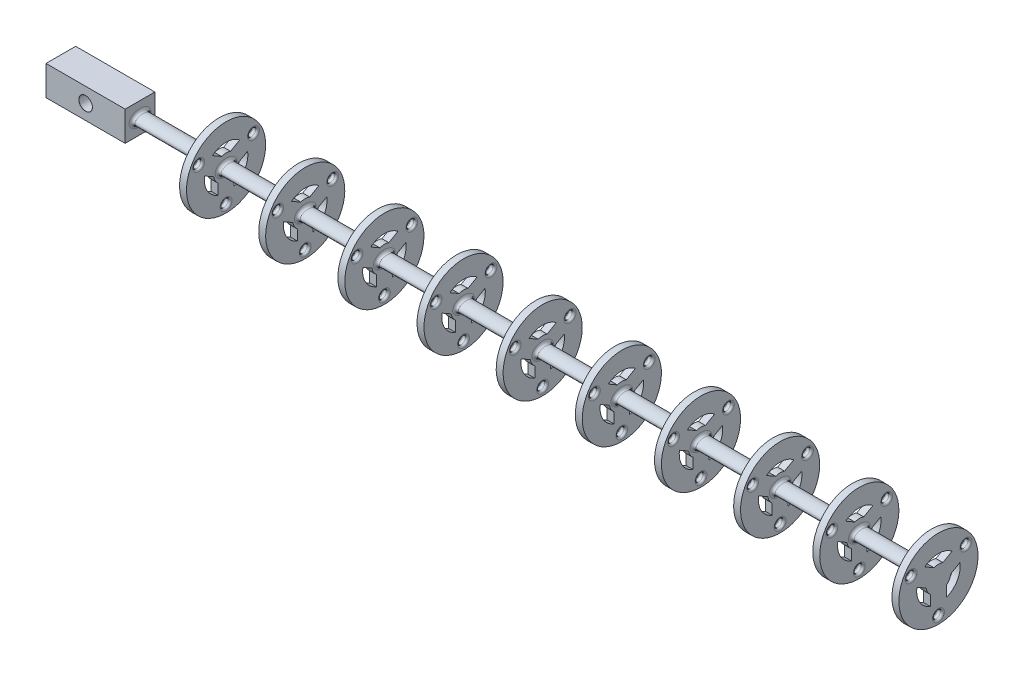
from build123d import *

# Parameters (mm, degrees)
SKETCH21_RX                    = 2
SKETCH21_RY                    = 1.25
BOSS_EXTRUDE6_DEPTH            = 200
SKETCH3_W                      = 1.75
SKETCH3_H                      = 10
CUT_EXTRUDE1_REACH             = 180.81
SKETCH5_R                      = 1
FILLET1_R                      = 0.5
LPATTERN1_COUNT                = 10
LPATTERN1_PITCH                = 20
FILLET1_OF_LPATTERN1_R         = 0.5
SKETCH16_W                     = 7.5
SKETCH16_H                     = 7.5
BOSS_EXTRUDE1_DEPTH            = 20
M3_CLEARANCE_HOLE1_D           = 3.4
M3_CLEARANCE_HOLE1_CSINK_D     = 3.45
M3_CLEARANCE_HOLE1_CSINK_ANGLE = 90
FILLET2_R                      = 0.75


with BuildPart() as part:
    # Sketch21 → Boss-Extrude6 (new body)
    with BuildSketch(Plane(origin=(0, 0, 0), x_dir=(0, 0, -1), z_dir=(1, 0, 0))):
        with Locations((0, 0)):
            Ellipse(SKETCH21_RX, SKETCH21_RY)
    extrude(amount=BOSS_EXTRUDE6_DEPTH)

    # Sketch3 → Revolve2 (revolve)
    with BuildSketch(Plane.XY):
        with Locations((20.875, 5)):
            Rectangle(SKETCH3_W, SKETCH3_H)
    revolve2 = revolve(axis=Axis((21.75, 0, 0), (-1, 0, 0)))

    # Sketch5 → Cut-Extrude1 (cut, up to next)
    with BuildSketch(Plane(origin=(21.75, 0, 0), x_dir=(0, 0, -1), z_dir=(1, 0, 0)), mode=Mode.PRIVATE) as cut_extrude1_sk1:
        with Locations((0, -8)):
            Circle(SKETCH5_R)
    cut_extrude1_tool1 = extrude(cut_extrude1_sk1.sketch, amount=-CUT_EXTRUDE1_REACH, mode=Mode.PRIVATE) & part.part
    # Sketch5 → Cut-Extrude1 (cut, up to next)
    with BuildSketch(Plane(origin=(21.75, 0, 0), x_dir=(0, 0, -1), z_dir=(1, 0, 0)), mode=Mode.PRIVATE) as cut_extrude1_sk2:
        with Locations((6.92820323, 4)):
            Circle(SKETCH5_R)
    cut_extrude1_tool2 = extrude(cut_extrude1_sk2.sketch, amount=-CUT_EXTRUDE1_REACH, mode=Mode.PRIVATE) & part.part
    # Sketch5 → Cut-Extrude1 (cut, up to next)
    with BuildSketch(Plane(origin=(21.75, 0, 0), x_dir=(0, 0, -1), z_dir=(1, 0, 0)), mode=Mode.PRIVATE) as cut_extrude1_sk3:
        with Locations((-6.92820323, 4)):
            Circle(SKETCH5_R)
    cut_extrude1_tool3 = extrude(cut_extrude1_sk3.sketch, amount=-CUT_EXTRUDE1_REACH, mode=Mode.PRIVATE) & part.part
    # Sketch5 → Cut-Extrude1 (cut, up to next)
    with BuildSketch(Plane(origin=(21.75, 0, 0), x_dir=(0, 0, -1), z_dir=(1, 0, 0)), mode=Mode.PRIVATE) as cut_extrude1_sk4:
        with BuildLine():
            Line((-3.437059837, 4.293788499), (-1.128202797, 2.960769265))
            ThreePointArc((-1.128202797, 2.960769265), (0, 3.1684375), (1.128202797, 2.960769265))
            Line((1.128202797, 2.960769265), (3.437059837, 4.293788499))
            ThreePointArc((3.437059837, 4.293788499), (0, 5.5), (-3.437059837, 4.293788499))
        make_face()
    cut_extrude1_tool4 = extrude(cut_extrude1_sk4.sketch, amount=-CUT_EXTRUDE1_REACH, mode=Mode.PRIVATE) & part.part
    # Sketch5 → Cut-Extrude1 (cut, up to next)
    with BuildSketch(Plane(origin=(21.75, 0, 0), x_dir=(0, 0, -1), z_dir=(1, 0, 0)), mode=Mode.PRIVATE) as cut_extrude1_sk5:
        with BuildLine():
            Line((2, -2.457436915), (2, -5.123475383))
            ThreePointArc((2, -5.123475383), (4.763139721, -2.75), (5.437059837, 0.829686884))
            Line((5.437059837, 0.829686884), (3.128202797, -0.50333235))
            ThreePointArc((3.128202797, -0.50333235), (2.743947365, -1.58421875), (2, -2.457436915))
        make_face()
    cut_extrude1_tool5 = extrude(cut_extrude1_sk5.sketch, amount=-CUT_EXTRUDE1_REACH, mode=Mode.PRIVATE) & part.part
    # Sketch5 → Cut-Extrude1 (cut, up to next)
    with BuildSketch(Plane(origin=(21.75, 0, 0), x_dir=(0, 0, -1), z_dir=(1, 0, 0)), mode=Mode.PRIVATE) as cut_extrude1_sk6:
        with BuildLine():
            Line((-3.128202797, -0.50333235), (-5.437059837, 0.829686884))
            ThreePointArc((-5.437059837, 0.829686884), (-4.763139721, -2.75), (-2, -5.123475383))
            Line((-2, -5.123475383), (-2, -2.457436915))
            ThreePointArc((-2, -2.457436915), (-2.743947365, -1.58421875), (-3.128202797, -0.50333235))
        make_face()
    cut_extrude1_tool6 = extrude(cut_extrude1_sk6.sketch, amount=-CUT_EXTRUDE1_REACH, mode=Mode.PRIVATE) & part.part
    cut_extrude1_1 = cut_extrude1_tool1.solids().sort_by_distance((21.75, -8, 0))[0]
    add(cut_extrude1_1, mode=Mode.SUBTRACT)
    cut_extrude1_2 = cut_extrude1_tool2.solids().sort_by_distance((21.75, 4, -6.928203))[0]
    add(cut_extrude1_2, mode=Mode.SUBTRACT)
    cut_extrude1_3 = cut_extrude1_tool3.solids().sort_by_distance((21.75, 4, 6.928203))[0]
    add(cut_extrude1_3, mode=Mode.SUBTRACT)
    cut_extrude1_4 = cut_extrude1_tool4.solids().sort_by_distance((21.75, 4.274526, 0))[0]
    add(cut_extrude1_4, mode=Mode.SUBTRACT)
    cut_extrude1_5 = cut_extrude1_tool5.solids().sort_by_distance((21.75, -2.137263, -3.701848))[0]
    add(cut_extrude1_5, mode=Mode.SUBTRACT)
    cut_extrude1_6 = cut_extrude1_tool6.solids().sort_by_distance((21.75, -2.137263, 3.701848))[0]
    add(cut_extrude1_6, mode=Mode.SUBTRACT)
    cut_extrude1 = cut_extrude1_1 + cut_extrude1_2 + cut_extrude1_3 + cut_extrude1_4 + cut_extrude1_5 + cut_extrude1_6  # Cut-Extrude1 as one shape, for the pattern or mirror that repeats it

    # Fillet1
    fillet1_edges = [part.edges().sort_by_distance(p)[0] for p in [
        (20, 4, -5.92820323),
        (20, -8, 1),
        (21.75, -8, 1),
        (21.75, 4, -5.92820323),
        (20, 4, 7.92820323),
        (21.75, 4, 7.92820323),
    ]]
    fillet(fillet1_edges, radius=FILLET1_R)

    # LPattern1: Revolve2, Cut-Extrude1 ×10
    with Locations(*[(i * LPATTERN1_PITCH, 0, 0) for i in range(1, LPATTERN1_COUNT)]):
        add(revolve2)
        add(cut_extrude1, mode=Mode.SUBTRACT)

    # Fillet1 of LPattern1
    fillet1_of_lpattern1_edges = [part.edges().sort_by_distance(p)[0] for p in [
        (40, 4, -5.92820323),
        (40, -8, 1),
        (41.75, -8, 1),
        (41.75, 4, -5.92820323),
        (40, 4, 7.92820323),
        (41.75, 4, 7.92820323),
        (60, 4, -5.92820323),
        (60, -8, 1),
        (61.75, -8, 1),
        (61.75, 4, -5.92820323),
        (60, 4, 7.92820323),
        (61.75, 4, 7.92820323),
        (80, 4, -5.92820323),
        (80, -8, 1),
        (81.75, -8, 1),
        (81.75, 4, -5.92820323),
        (80, 4, 7.92820323),
        (81.75, 4, 7.92820323),
        (100, 4, -5.92820323),
        (100, -8, 1),
        (101.75, -8, 1),
        (101.75, 4, -5.92820323),
        (100, 4, 7.92820323),
        (101.75, 4, 7.92820323),
        (120, 4, -5.92820323),
        (120, -8, 1),
        (121.75, -8, 1),
        (121.75, 4, -5.92820323),
        (120, 4, 7.92820323),
        (121.75, 4, 7.92820323),
        (140, 4, -5.92820323),
        (140, -8, 1),
        (141.75, -8, 1),
        (141.75, 4, -5.92820323),
        (140, 4, 7.92820323),
        (141.75, 4, 7.92820323),
        (160, 4, -5.92820323),
        (160, -8, 1),
        (161.75, -8, 1),
        (161.75, 4, -5.92820323),
        (160, 4, 7.92820323),
        (161.75, 4, 7.92820323),
        (180, 4, -5.92820323),
        (180, -8, 1),
        (181.75, -8, 1),
        (181.75, 4, -5.92820323),
        (180, 4, 7.92820323),
        (181.75, 4, 7.92820323),
        (200, 4, -5.92820323),
        (200, -8, 1),
        (201.75, -8, 1),
        (201.75, 4, -5.92820323),
        (200, 4, 7.92820323),
        (201.75, 4, 7.92820323),
    ]]
    fillet(fillet1_of_lpattern1_edges, radius=FILLET1_OF_LPATTERN1_R)

    # Sketch16 → Boss-Extrude1 (add)
    with BuildSketch(Plane(origin=(0, 0, 0), x_dir=(0, 0, -1), z_dir=(1, 0, 0))):
        Rectangle(SKETCH16_W, SKETCH16_H)
    extrude(amount=-BOSS_EXTRUDE1_DEPTH)

    # M3 Clearance Hole1 (through all)
    with Locations(Plane.XY.offset(3.75)):
        with Locations((-10, 0)):
            CounterSinkHole(M3_CLEARANCE_HOLE1_D / 2, M3_CLEARANCE_HOLE1_CSINK_D / 2, counter_sink_angle=M3_CLEARANCE_HOLE1_CSINK_ANGLE)

    # Fillet2
    fillet2_edges = [part.edges().sort_by_distance(p)[0] for p in [
        (200, -0.002166608, 1.999996996),
        (181.75, 0, 2.000000063),
        (180, 0, 2.000000063),
        (161.75, 0, 2.000000063),
        (160, 0, 2.000000063),
        (141.75, 0, 2.000000063),
        (140, 0, 2.000000063),
        (121.75, 0, 2.000000063),
        (120, 0, 2.000000063),
        (101.75, 0, 2.000000063),
        (100, 0, 2.000000063),
        (81.75, 0, 2.000000063),
        (80, 0, 2.000000063),
        (61.75, 0, 2.000000063),
        (60, 0, 2.000000063),
        (41.75, 0, 2.000000063),
        (40, 0, 2.000000063),
        (21.75, 0, 2.000000063),
        (20, 0, 2.000000063),
        (0, -0.002166608, 1.999996996),
    ]]
    fillet(fillet2_edges, radius=FILLET2_R)


solid = part.part
